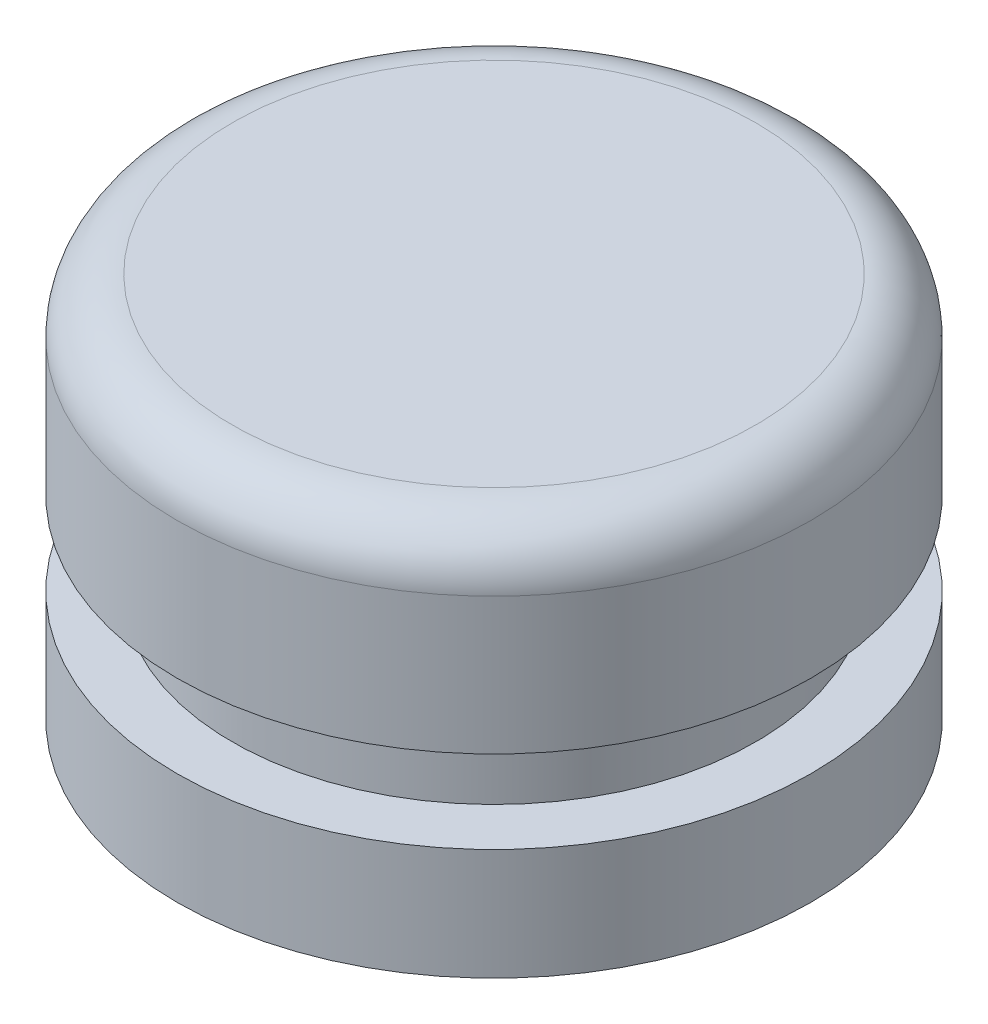
from build123d import *

# Parameters (mm, degrees)
FILLET1_R = 2
FILLET2_R = 2
FILLET3_R = 2
FILLET4_R = 1


with BuildPart() as part:
    # Sketch1 → Revolve1 (revolve)
    with BuildSketch(Plane.XY, mode=Mode.PRIVATE) as revolve1_sk:
        Polygon((-0.5, 8.956259778), (-6.25, 8.956259778), (-6.25, 5.477980263), (-5.25, 5.477980263), (-5.25, 3.977980263), (-6.25, 3.977980263), (-6.25, 1.956259778), (-5.25, 1.956259778), (-5.25, 2.977980263), (-4.25, 2.977980263), (-4.25, 6.477980263), (-5.25, 6.477980263), (-5.25, 7.956259778), (-0.5, 7.956259778), align=None)
    revolve(revolve1_sk.sketch.rotate(Axis((-0.5, 1.956259778, 0), (0, 1, 0)), 270), axis=Axis((-0.5, 1.956259778, 0), (0, 1, 0)))

    # Fillet1
    # the kernel refuses this fillet: 2 mm, written as the material it takes off along each edge
    with BuildSketch(Plane(origin=(-0.5, 2.977980263, 0), x_dir=(0, 0, -1), z_dir=(1, 0, 0))) as fillet1_piece_1:
        with BuildLine():
            CenterArc((5.75, 1.732050808), FILLET1_R, 180, 60)
            Line((3.75, 1.732050808), (3.71, 1.732050808))
            Line((3.71, 1.732050808), (3.71, 0))
            Line((3.71, 0), (3.75, -0.04))
            ThreePointArc((3.75, -0.04), (4.25, -0.04), (4.73, -0.034641016))
            Line((4.73, -0.034641016), (4.75, 0))
        make_face()
    revolve(axis=Axis((-0.5, 2.977980263, 0), (0, 1, 0)), mode=Mode.SUBTRACT)

    # Fillet2
    fillet2_edges = [part.edges().sort_by_distance(p)[0] for p in [
        (-0.5, 2.977980263, 4.75),
    ]]
    fillet(fillet2_edges, radius=FILLET2_R)

    # Fillet3
    # the kernel refuses this fillet: 2 mm, written as the material it takes off along each edge
    with BuildSketch(Plane(origin=(-0.5, 6.477980263, 0), x_dir=(0, 0, -1), z_dir=(1, 0, 0))) as fillet3_piece_1:
        with BuildLine():
            CenterArc((5.75, -1.732050808), FILLET3_R, 120, 60)
            Line((4.75, 0), (4.73, 0.034641016))
            ThreePointArc((4.73, 0.034641016), (4.25, 0.04), (3.75, 0.04))
            Line((3.75, 0.04), (3.71, 0))
            Line((3.71, 0), (3.71, -1.732050808))
            Line((3.71, -1.732050808), (3.75, -1.732050808))
        make_face()
    revolve(axis=Axis((-0.5, 6.477980263, 0), (0, 1, 0)), mode=Mode.SUBTRACT)

    # Fillet4
    fillet4_edges = [part.edges().sort_by_distance(p)[0] for p in [
        (-0.5, 8.956259778, 5.75),
    ]]
    fillet(fillet4_edges, radius=FILLET4_R)


solid = part.part
